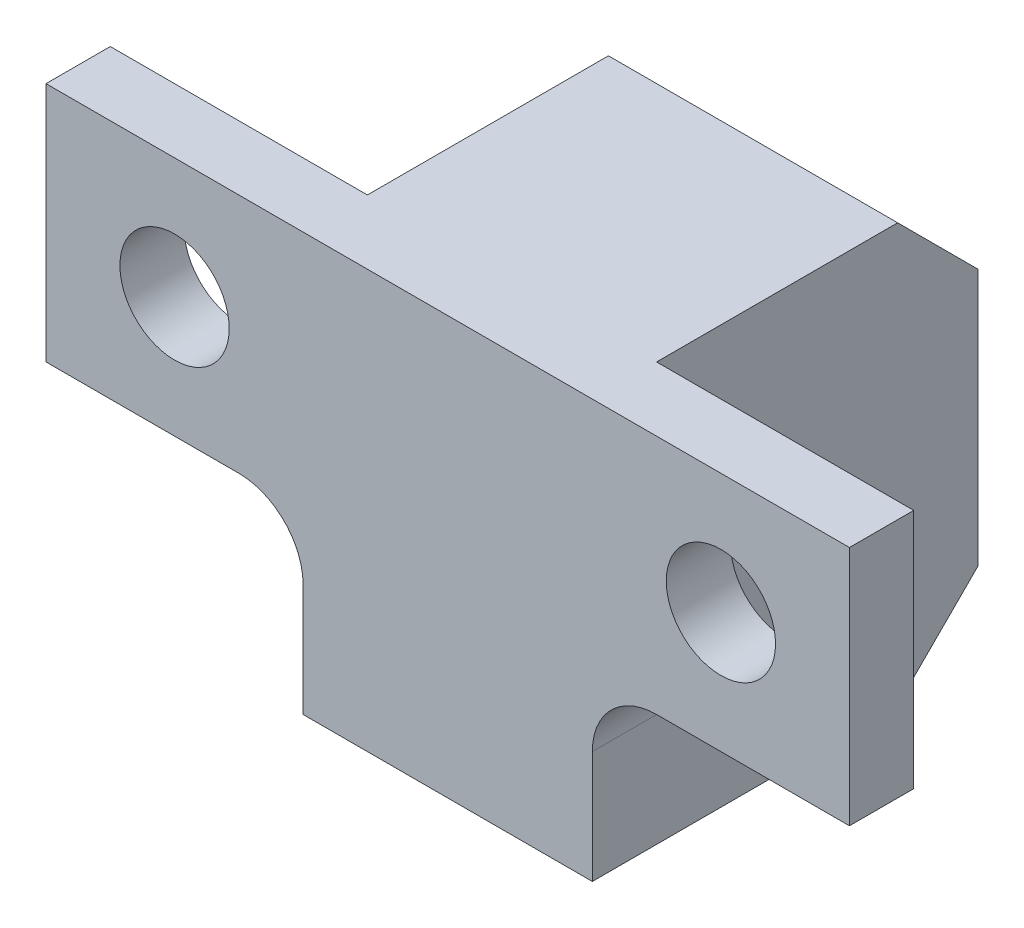
from build123d import *

# Parameters (mm, degrees)
BOSS_EXTRUDE1_DEPTH         = 15
CUT_EXTRUDE2_DEPTH          = 31.822070015
CUT_EXTRUDE2_DEPTH_BACK     = 31.822070015
M3_CLEARANCE_HOLE1_D        = 3.4
M3_CLEARANCE_HOLE1_DEPTH    = 3.9
M3_CLEARANCE_HOLE1_TIP      = 1.021463052
TAP_DRILL_FOR_M3X0_5_TAP1_D = 2.5
CHAMFER2_SIZE               = 2.5
FILLET1_R                   = 2


with BuildPart() as part:
    # Sketch1 → Boss-Extrude1 (new body)
    with BuildSketch(Plane(origin=(0, 0, 0), x_dir=(1, 0, 0), z_dir=(0, 1, 0))):
        Polygon((0, 0), (8, 0), (8, 10), (17, 10), (17, 0), (25, 0), (25, -2), (0, -2), align=None)
    extrude(amount=BOSS_EXTRUDE1_DEPTH)

    # Sketch5 → Cut-Extrude2 (cut, two sides: drawn at the far end of the back side and taken through both)
    with BuildSketch(Plane(origin=(0, 0, 0), x_dir=(-1, 0, 0), z_dir=(0, 0, -1)).offset(-CUT_EXTRUDE2_DEPTH_BACK)):
        Polygon((-25, 7.5), (-17, 7.5), (-17, 2), (-8, 2), (-8, 7.5), (0, 7.5), (0, 0), (-8, 0), (-17, 0), (-25, 0), align=None)
    extrude(amount=CUT_EXTRUDE2_DEPTH + CUT_EXTRUDE2_DEPTH_BACK, mode=Mode.SUBTRACT)

    # M3 Clearance Hole1
    with Locations(Plane(origin=(0, 0, 0), x_dir=(-1, 0, 0), z_dir=(0, 0, -1))):
        with Locations((-4, 11.25), (-21, 11.25)):
            Hole(M3_CLEARANCE_HOLE1_D / 2, depth=M3_CLEARANCE_HOLE1_DEPTH)
            with Locations((0, 0, -(M3_CLEARANCE_HOLE1_DEPTH + M3_CLEARANCE_HOLE1_TIP / 2))):  # 118° drill point
                Cone(0, M3_CLEARANCE_HOLE1_D / 2, M3_CLEARANCE_HOLE1_TIP, mode=Mode.SUBTRACT)

    # Tap Drill for M3x0.5 Tap1 (through all)
    with Locations(Plane.ZY.offset(-8)):
        with Locations((-6, 5.25)):
            Hole(TAP_DRILL_FOR_M3X0_5_TAP1_D / 2)

    # Chamfer2
    chamfer2_edges = [part.edges().sort_by_distance(p)[0] for p in [
        (12.5, 15, -10),
        (12.5, 2, -10),
    ]]
    chamfer(chamfer2_edges, length=CHAMFER2_SIZE)

    # Fillet1
    fillet1_edges = [part.edges().sort_by_distance(p)[0] for p in [
        (17, 7.5, 1),
        (8, 7.5, 1),
    ]]
    fillet(fillet1_edges, radius=FILLET1_R)


solid = part.part
